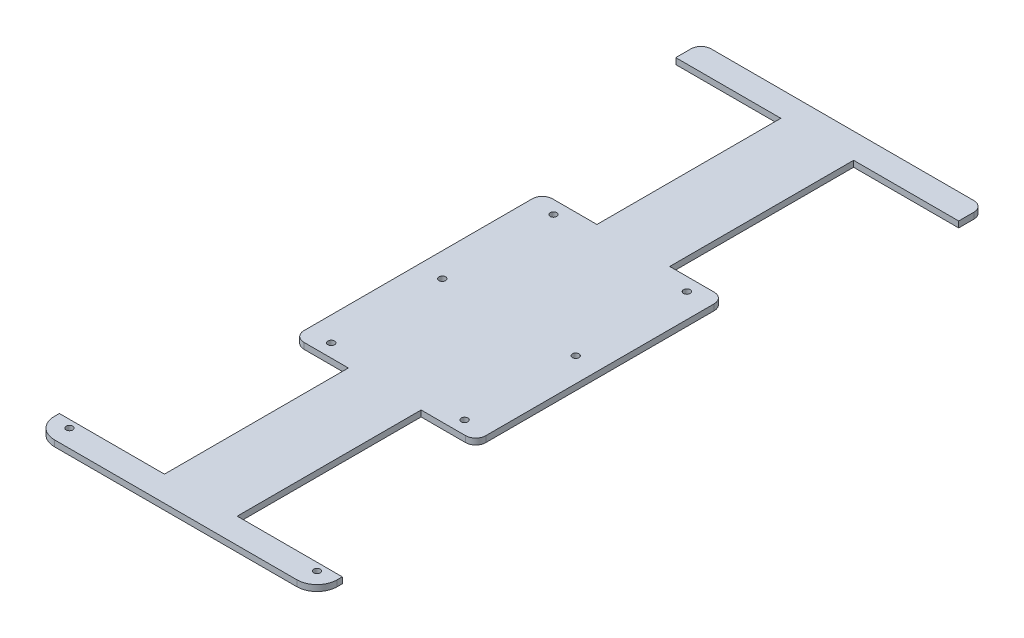
from build123d import *

# Parameters (mm, degrees)
BOSS_EXTRUDE1_DEPTH = 3
FILLET1_R           = 10
FILLET2_R           = 5
SKETCH2_R           = 1.65
CUT_EXTRUDE1_DEPTH  = 359.481519747
SKETCH3_R           = 1.65
CUT_EXTRUDE2_DEPTH  = 359.481519747


with BuildPart() as part:
    # Sketch1 → Boss-Extrude1 (new body)
    with BuildSketch(Plane(origin=(0, 0, 0), x_dir=(1, 0, 0), z_dir=(0, 1, 0))):
        Polygon((0, 0), (140, 0), (140, 12.5), (88, 12.5), (88, 103.5), (115, 103.5), (115, 226.5), (88, 226.5), (88, 317.5), (140, 317.5), (140, 330), (0, 330), (0, 317.5), (52, 317.5), (52, 226.5), (25, 226.5), (25, 103.5), (52, 103.5), (52, 12.5), (0, 12.5), align=None)
    extrude(amount=BOSS_EXTRUDE1_DEPTH)

    # Fillet1
    fillet1_edges = [part.edges().sort_by_distance(p)[0] for p in [
        (140, 1.5, 0),
        (0, 1.5, 0),
    ]]
    fillet(fillet1_edges, radius=FILLET1_R)

    # Fillet2
    fillet2_edges = [part.edges().sort_by_distance(p)[0] for p in [
        (0, 1.5, -330),
        (140, 1.5, -330),
        (115, 1.5, -226.5),
        (115, 1.5, -103.5),
        (25, 1.5, -103.5),
        (25, 1.5, -226.5),
    ]]
    fillet(fillet2_edges, radius=FILLET2_R)

    # Sketch2 → Cut-Extrude1 (cut, through all)
    with BuildSketch(Plane(origin=(0, 3, 0), x_dir=(1, 0, 0), z_dir=(0, 1, 0))):
        with Locations((37, 220)):
            Circle(SKETCH2_R)
        with Locations((37, 165)):
            Circle(SKETCH2_R)
        with Locations((37, 110)):
            Circle(SKETCH2_R)
        with Locations((103, 110)):
            Circle(SKETCH2_R)
        with Locations((103, 165)):
            Circle(SKETCH2_R)
        with Locations((103, 220)):
            Circle(SKETCH2_R)
    extrude(amount=-CUT_EXTRUDE1_DEPTH, mode=Mode.SUBTRACT)

    # Sketch3 → Cut-Extrude2 (cut, through all)
    with BuildSketch(Plane(origin=(0, 3, 0), x_dir=(1, 0, 0), z_dir=(0, 1, 0))):
        with Locations((8.75, 8.75)):
            Circle(SKETCH3_R)
        with Locations((131.25, 8.75)):
            Circle(SKETCH3_R)
    extrude(amount=-CUT_EXTRUDE2_DEPTH, mode=Mode.SUBTRACT)


solid = part.part
